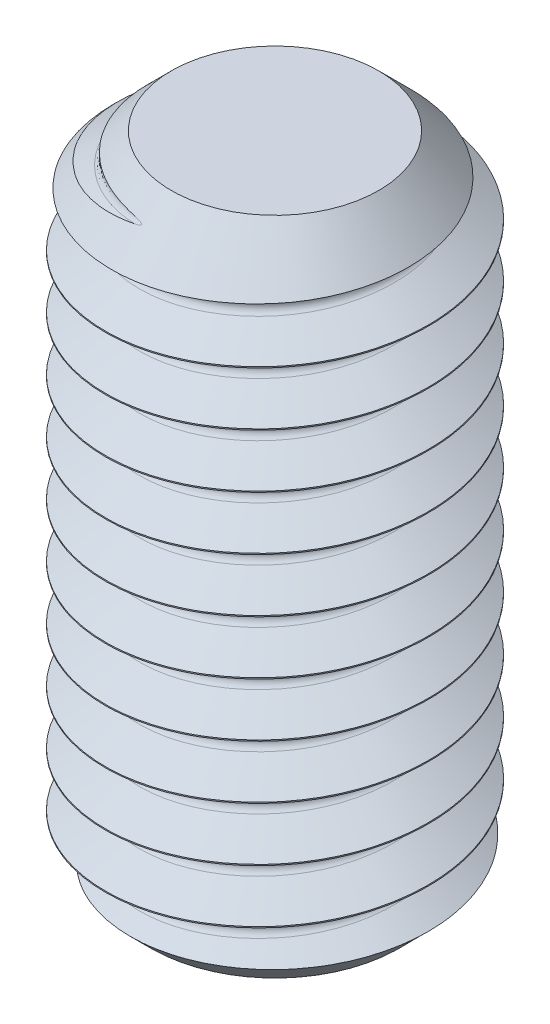
from build123d import *

# Parameters (mm, degrees)
SKETCH1_R               = 3
BOSS_EXTRUDE1_DEPTH     = 6.585
CUT_EXTRUDE1_DEPTH      = 2.5
CUT_SWEEP1_PITCH        = 0.9999999999999979
CUT_SWEEP1_HEIGHT       = 14.500000000000012
CUT_SWEEP1_RADIUS       = 3.0000000000000004
CUT_SWEEP1_START_ANGLE  = -90.00000000000061
CUT_EXTRUDE3_DEPTH      = 8.833409409510612
CUT_EXTRUDE3_DEPTH_BACK = 8.833409409510612


with BuildPart() as part:
    # Sketch1 → Boss-Extrude1 (new, symmetric)
    with BuildSketch(Plane(origin=(0, 0, 0), x_dir=(1, 0, 0), z_dir=(0, 1, 0))):
        with Locations(Location((0, 0, 0), (0, 0, 270))):
            Circle(SKETCH1_R)
    extrude(amount=BOSS_EXTRUDE1_DEPTH, both=True)

    # Sketch2 → Cut-Revolve1 (revolve, cut)
    with BuildSketch(Plane.XY, mode=Mode.PRIVATE) as cut_revolve1_sk:
        Polygon((0.7499999999999993, 6.585), (5.95071076992471, 1.3842892300753107), (5.950710769924711, -2.9342892300753007), (2.3000000000000003, -6.585), (2.300000000000001, -11.440460971437306), (9.871352994383097, -11.440460971437306), (9.871352994383097, 12.204396091061327), (0.7499999999999984, 12.204396091061327), align=None)
    revolve(cut_revolve1_sk.sketch.rotate(Axis((0, 0, 0), (0, -1, 0)), 270), axis=Axis((0, 0, 0), (0, -1, 0)), mode=Mode.SUBTRACT)

    # Sketch3 → Cut-Extrude1 (cut)
    with BuildSketch(Plane.XZ.offset(6.585)):
        Polygon((1.54, -0.8891194145520241), (1.5399999999999998, 0.8891194145520247), (4.3e-16, 1.778238829104048), (-1.54, 0.8891194145520245), (-1.54, -0.8891194145520235), (-4.1e-16, -1.7782388291040474), align=None)
    extrude(amount=-CUT_EXTRUDE1_DEPTH, mode=Mode.SUBTRACT)

    # Cut-Sweep1: sweep along a helix
    with BuildLine() as cut_sweep1_path:
        add(Helix(CUT_SWEEP1_PITCH, CUT_SWEEP1_HEIGHT, CUT_SWEEP1_RADIUS, center=(0, -6.585, 0), direction=(0, 1, 0), mode=Mode.PRIVATE).rotate(Axis((0, -6.585, 0), (0, 1, 0)), CUT_SWEEP1_START_ANGLE))
    # Sketch5 → Cut-Sweep1 (sweep, cut)
    with BuildSketch(Plane.XY):
        with BuildLine():
            Line((3.0096960478383856, -6.14771056931802), (2.3687808980917904, -6.5177431035519255))
            ThreePointArc((2.3687808980917904, -6.5177431035519255), (2.2966308980917907, -6.6427105693180195), (2.368780898091791, -6.767678035084113))
            Line((2.368780898091791, -6.767678035084113), (3.0096960478383856, -7.13771056931802))
            Line((3.0096960478383856, -7.13771056931802), (3.0096960478383856, -6.14771056931802))
        make_face()
    sweep(path=cut_sweep1_path.line, is_frenet=True, mode=Mode.SUBTRACT)

    # Cut-Extrude2 cone 1 section (through the dimple's axis) → Cut-Extrude2 (revolve, cut)
    with BuildSketch(Plane(origin=(0, -6.585, 0), x_dir=(0, 0, -1), z_dir=(1, 0, 0))):
        Polygon((0, 0), (1.778238829, 0), (0, 0.476477658), align=None)
    revolve(axis=Axis((0, -6.585, 0), (0, 1, 0)), mode=Mode.SUBTRACT)

    # Sketch8 → Cut-Extrude3 (cut, two sides: drawn at the far end of the back side and taken through both)
    with BuildSketch(Plane.XY.offset(-CUT_EXTRUDE3_DEPTH_BACK)):
        Polygon((-1.9249999999999967, 5.410000000000003), (1.9250000000000034, 5.410000000000003), (1.9250000000000043, 7.14711053197616), (-1.9249999999999963, 7.1471105319761605), align=None)
    extrude(amount=CUT_EXTRUDE3_DEPTH + CUT_EXTRUDE3_DEPTH_BACK, mode=Mode.SUBTRACT)


solid = part.part
